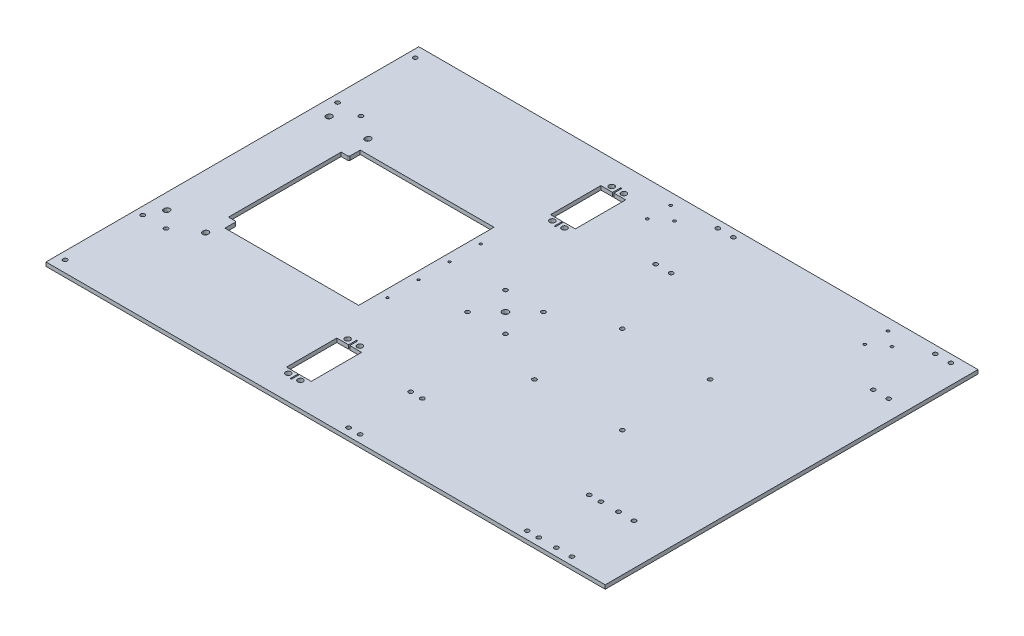
from build123d import *

# Parameters (mm, degrees)
SKETCH1_W           = 457.2
SKETCH1_H           = 304.8
BOSS_EXTRUDE1_DEPTH = 3.175
CUT_EXTRUDE1_DEPTH  = 275.761352131
CUT_EXTRUDE2_REACH  = 276.761
SKETCH5_R           = 1.700000029
CUT_EXTRUDE3_DEPTH  = 275.761352131
SKETCH7_R           = 2.200000045
CUT_EXTRUDE5_DEPTH  = 275.761352131
SKETCH8_R           = 1.000000032
CUT_EXTRUDE6_DEPTH  = 275.761352131
SKETCH12_R          = 1.700000029
CUT_EXTRUDE7_DEPTH  = 275.761352131
SKETCH13_R          = 1.700000029
SKETCH13_R_2        = 1.127000032
CUT_EXTRUDE8_DEPTH  = 275.761352131
SKETCH14_R          = 1.700000029
SKETCH14_R_2        = 2.499999953
CUT_EXTRUDE9_DEPTH  = 275.761352131


with BuildPart() as part:
    # Sketch1 → Boss-Extrude1 (new body)
    with BuildSketch(Plane(origin=(0, 0, 0), x_dir=(1, 0, 0), z_dir=(0, 1, 0))):
        Rectangle(SKETCH1_W, SKETCH1_H)
    extrude(amount=BOSS_EXTRUDE1_DEPTH)

    # Sketch2 → Cut-Extrude1 (cut, through all)
    with BuildSketch(Plane(origin=(0, 3.175, 0), x_dir=(1, 0, 0), z_dir=(0, 1, 0))):
        with BuildLine():
            Line((-218.100000045, 66.04), (-218.100000045, 66.675))
            ThreePointArc((-218.100000045, 66.675), (-215.9, 68.875000045), (-213.699999955, 66.675))
            Line((-213.699999955, 66.675), (-213.699999955, 66.04))
            ThreePointArc((-213.699999955, 66.04), (-215.9, 63.839999955), (-218.100000045, 66.04))
        make_face()
        with BuildLine():
            Line((-186.350000045, 66.04), (-186.350000045, 66.675))
            ThreePointArc((-186.350000045, 66.675), (-184.15, 68.875000045), (-181.949999955, 66.675))
            Line((-181.949999955, 66.675), (-181.949999955, 66.04))
            ThreePointArc((-181.949999955, 66.04), (-184.15, 63.839999955), (-186.350000045, 66.04))
        make_face()
        with BuildLine():
            Line((-213.699999955, -66.04), (-213.699999955, -66.675))
            ThreePointArc((-213.699999955, -66.675), (-215.9, -68.875000045), (-218.100000045, -66.675))
            Line((-218.100000045, -66.675), (-218.100000045, -66.04))
            ThreePointArc((-218.100000045, -66.04), (-215.9, -63.839999955), (-213.699999955, -66.04))
        make_face()
        with BuildLine():
            Line((-181.949999955, -66.04), (-181.949999955, -66.675))
            ThreePointArc((-181.949999955, -66.675), (-184.15, -68.875000045), (-186.350000045, -66.675))
            Line((-186.350000045, -66.675), (-186.350000045, -66.04))
            ThreePointArc((-186.350000045, -66.04), (-184.15, -63.839999955), (-181.949999955, -66.04))
        make_face()
    extrude(amount=-CUT_EXTRUDE1_DEPTH, mode=Mode.SUBTRACT)

    # Sketch4 → Cut-Extrude2 (cut, up to next)
    with BuildSketch(Plane(origin=(0, 3.175, 0), x_dir=(1, 0, 0), z_dir=(0, 1, 0)), mode=Mode.PRIVATE) as cut_extrude2_sk1:
        with BuildLine():
            Line((-185.7375, 46.0375), (-185.7375, -46.0375))
            Line((-185.7375, -46.0375), (-180.34, -46.0375))
            ThreePointArc((-180.34, -46.0375), (-179.666480791, -46.316480791), (-179.3875, -46.99))
            Line((-179.3875, -46.99), (-179.3875, -55.3085))
            Line((-179.3875, -55.3085), (-70.0405, -55.3085))
            Line((-70.0405, -55.3085), (-70.0405, 55.3085))
            Line((-70.0405, 55.3085), (-179.3875, 55.3085))
            Line((-179.3875, 55.3085), (-179.3875, 46.99))
            ThreePointArc((-179.3875, 46.99), (-179.666480791, 46.316480791), (-180.34, 46.0375))
            Line((-180.34, 46.0375), (-185.7375, 46.0375))
        make_face()
    cut_extrude2_tool1 = extrude(cut_extrude2_sk1.sketch, amount=-CUT_EXTRUDE2_REACH, mode=Mode.PRIVATE) & part.part
    add(cut_extrude2_tool1.solids().sort_by_distance((-127.382939, 3.175, 0))[0], mode=Mode.SUBTRACT)

    # Sketch5 → Cut-Extrude3 (cut, through all)
    with BuildSketch(Plane(origin=(0, 3.175, 0), x_dir=(1, 0, 0), z_dir=(0, 1, 0))):
        with Locations((-203.2, 79.629)):
            Circle(SKETCH5_R)
        with Locations((-222.25, 143.129)):
            Circle(SKETCH5_R)
        with Locations((-222.25, 79.629)):
            Circle(SKETCH5_R)
        with Locations((-203.2, -79.629)):
            Circle(SKETCH5_R)
        with Locations((-222.25, -79.629)):
            Circle(SKETCH5_R)
        with Locations((-222.25, -143.129)):
            Circle(SKETCH5_R)
    extrude(amount=-CUT_EXTRUDE3_DEPTH, mode=Mode.SUBTRACT)

    # Sketch7 → Cut-Extrude5 (cut, through all)
    with BuildSketch(Plane(origin=(0, 3.175, 0), x_dir=(1, 0, 0), z_dir=(0, 1, 0))):
        with Locations((-50.720000033, -132.250000041)):
            Circle(SKETCH7_R)
        with Locations((-40.719999967, -132.250000041)):
            Circle(SKETCH7_R)
        with Locations((-50.720000033, -83.649999959)):
            Circle(SKETCH7_R)
        with Locations((-40.719999967, -83.649999959)):
            Circle(SKETCH7_R)
        Polygon((-55.846999939, -87.373000006), (-46.22, -87.373000006), (-46.22, -80.769000006), (-45.22, -80.769000006), (-45.22, -87.373000006), (-35.593000061, -87.373000006), (-35.593000061, -128.526999994), (-45.22, -128.526999994), (-45.22, -135.130999994), (-46.22, -135.130999994), (-46.22, -128.526999994), (-55.846999939, -128.526999994), align=None)
    cut_extrude5 = extrude(amount=-CUT_EXTRUDE5_DEPTH, mode=Mode.SUBTRACT)

    # Mirror1: Cut-Extrude5 across plane
    add(cut_extrude5.mirror(Plane.XY), mode=Mode.SUBTRACT)

    # Sketch8 → Cut-Extrude6 (cut, through all)
    with BuildSketch(Plane(origin=(0, 3.175, 0), x_dir=(1, 0, 0), z_dir=(0, 1, 0))):
        with Locations((-63.6905, -38.1)):
            Circle(SKETCH8_R)
        with Locations((-63.6905, -12.7)):
            Circle(SKETCH8_R)
        with Locations((-63.6905, 12.7)):
            Circle(SKETCH8_R)
        with Locations((-63.6905, 38.1)):
            Circle(SKETCH8_R)
    extrude(amount=-CUT_EXTRUDE6_DEPTH, mode=Mode.SUBTRACT)

    # Sketch12 → Cut-Extrude7 (cut, through all)
    with BuildSketch(Plane(origin=(0, 3.175, 0), x_dir=(1, 0, 0), z_dir=(0, 1, 0))):
        with Locations((195.024, -95.25)):
            Circle(SKETCH12_R)
        with Locations((182.324, -95.25)):
            Circle(SKETCH12_R)
        with Locations((195.024, -146.05)):
            Circle(SKETCH12_R)
        with Locations((182.324, -146.05)):
            Circle(SKETCH12_R)
        with Locations((167.9575, -95.25)):
            Circle(SKETCH12_R)
        with Locations((158.4325, -95.25)):
            Circle(SKETCH12_R)
        with Locations((167.9575, -146.05)):
            Circle(SKETCH12_R)
        with Locations((158.4325, -146.05)):
            Circle(SKETCH12_R)
        with Locations((21.9075, -146.05)):
            Circle(SKETCH12_R)
        with Locations((12.3825, -146.05)):
            Circle(SKETCH12_R)
        with Locations((12.3825, -95.25)):
            Circle(SKETCH12_R)
        with Locations((21.9075, -95.25)):
            Circle(SKETCH12_R)
    extrude(amount=-CUT_EXTRUDE7_DEPTH, mode=Mode.SUBTRACT)

    # Sketch13 → Cut-Extrude8 (cut, through all)
    with BuildSketch(Plane(origin=(0, 3.175, 0), x_dir=(1, 0, 0), z_dir=(0, 1, 0))):
        with Locations((212.725, 95.25)):
            Circle(SKETCH13_R)
        with Locations((212.725, 146.05)):
            Circle(SKETCH13_R)
        with Locations((200.025, 95.25)):
            Circle(SKETCH13_R)
        with Locations((200.025, 146.05)):
            Circle(SKETCH13_R)
        with Locations((177.213, 133.477000026)):
            Circle(SKETCH13_R_2)
        with Locations((164.513, 143.002000026)):
            Circle(SKETCH13_R_2)
        with Locations((164.513, 123.952000026)):
            Circle(SKETCH13_R_2)
        with Locations((34.925, 95.25)):
            Circle(SKETCH13_R)
        with Locations((34.925, 146.05)):
            Circle(SKETCH13_R)
        with Locations((22.225, 95.25)):
            Circle(SKETCH13_R)
        with Locations((22.225, 146.05)):
            Circle(SKETCH13_R)
        with Locations((-0.587, 133.477000026)):
            Circle(SKETCH13_R_2)
        with Locations((-13.287, 143.002000026)):
            Circle(SKETCH13_R_2)
        with Locations((-13.287, 123.952000026)):
            Circle(SKETCH13_R_2)
    extrude(amount=-CUT_EXTRUDE8_DEPTH, mode=Mode.SUBTRACT)

    # Sketch14 → Cut-Extrude9 (cut, through all)
    with BuildSketch(Plane(origin=(0, 3.175, 0), x_dir=(1, 0, 0), z_dir=(0, 1, 0))):
        with Locations((54.248975516, 35.921024484)):
            Circle(SKETCH14_R)
        with Locations((126.091024484, 35.921024484)):
            Circle(SKETCH14_R)
        with Locations((54.248975516, -35.921024484)):
            Circle(SKETCH14_R)
        with Locations((126.091024484, -35.921024484)):
            Circle(SKETCH14_R)
        with Locations((-20.833999988, 15.499999988)):
            Circle(SKETCH14_R)
        with Locations((10.165999988, 15.499999988)):
            Circle(SKETCH14_R)
        with Locations((-20.833999988, -15.499999988)):
            Circle(SKETCH14_R)
        with Locations((10.165999988, -15.499999988)):
            Circle(SKETCH14_R)
        with Locations((-5.334, 0)):
            Circle(SKETCH14_R_2)
    extrude(amount=-CUT_EXTRUDE9_DEPTH, mode=Mode.SUBTRACT)


solid = part.part
